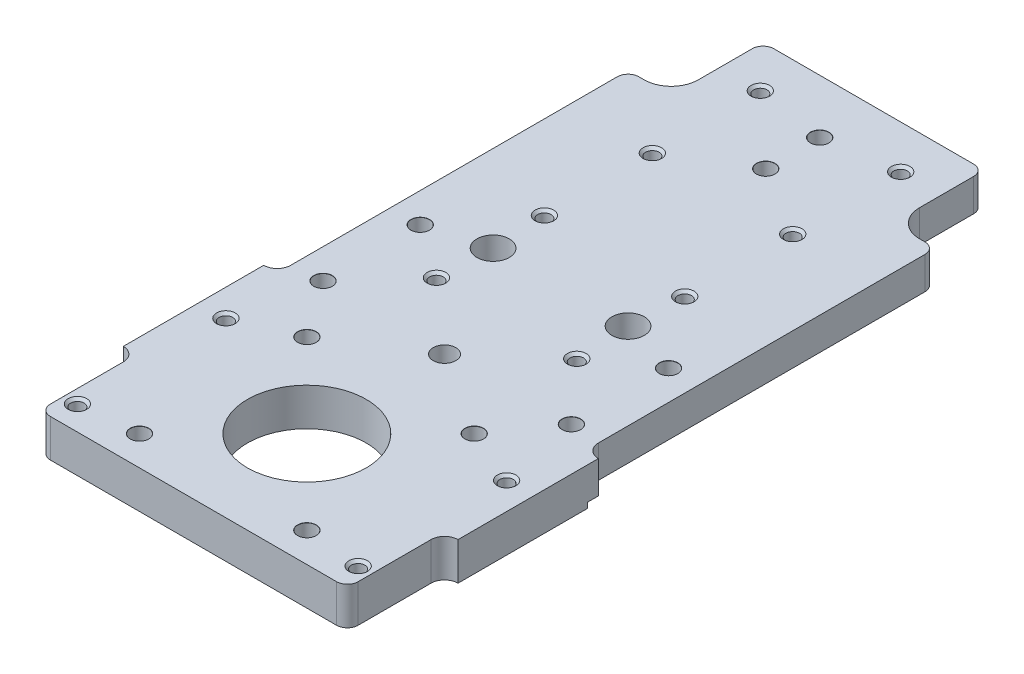
from build123d import *

# Parameters (mm, degrees)
PLATE_MAIN_SKETCH_R             = 11
PLATE_MAIN_SKETCH_R_2           = 3
EXTRUDE_PLATE_MAIN_DEPTH        = 7
CORNER_FILLETS_R                = 2
M3X0_5_TAPPED_HOLES_AT_2_COUNT  = 2
M3X0_5_TAPPED_HOLES_AT_2_PITCH  = 27.5
M3X0_5_TAPPED_HOLES_AT_3_COUNT  = 2
M3X0_5_TAPPED_HOLES_AT_3_PITCH  = 58.823889705
M3X0_5_TAPPED_HOLES_AT_4_COUNT  = 2
M3X0_5_TAPPED_HOLES_AT_4_PITCH  = 66.206117542
M3X0_5_TAPPED_HOLES_AT_5_COUNT  = 2
M3X0_5_TAPPED_HOLES_AT_5_PITCH  = 83.20606949
M3X0_5_TAPPED_HOLES_AT_6_COUNT  = 2
M3X0_5_TAPPED_HOLES_AT_6_PITCH  = 101.307699609
M3X0_5_TAPPED_HOLES_AT_7_COUNT  = 2
M3X0_5_TAPPED_HOLES_AT_7_PITCH  = 120.013540903
M3X0_5_TAPPED_HOLES_AT_8_COUNT  = 2
M3X0_5_TAPPED_HOLES_AT_8_PITCH  = 114.242067558
M3X0_5_TAPPED_HOLES_AT_9_COUNT  = 2
M3X0_5_TAPPED_HOLES_AT_9_PITCH  = 94.399417371
M3X0_5_TAPPED_HOLES_AT_10_COUNT = 2
M3X0_5_TAPPED_HOLES_AT_10_PITCH = 74.640806534
M3X0_5_TAPPED_HOLES_AT_11_COUNT = 2
M3X0_5_TAPPED_HOLES_AT_11_PITCH = 55.056788864
M3X0_5_TAPPED_HOLES_AT_12_COUNT = 2
M3X0_5_TAPPED_HOLES_AT_12_PITCH = 52
M3_COUNTER_BORES_AT_2_COUNT     = 2
M3_COUNTER_BORES_AT_2_PITCH     = 31
M3_COUNTER_BORES_AT_3_COUNT     = 2
M3_COUNTER_BORES_AT_3_PITCH     = 43.840620434
M3_COUNTER_BORES_AT_4_COUNT     = 2
M3_COUNTER_BORES_AT_4_PITCH     = 31
M3_COUNTER_BORES_AT_5_COUNT     = 2
M3_COUNTER_BORES_AT_5_PITCH     = 42.172265768
M3_COUNTER_BORES_AT_6_COUNT     = 2
M3_COUNTER_BORES_AT_6_PITCH     = 56.608303278
M3_COUNTER_BORES_AT_7_COUNT     = 2
M3_COUNTER_BORES_AT_7_PITCH     = 70.86959856
M3_COUNTER_BORES_AT_8_COUNT     = 2
M3_COUNTER_BORES_AT_8_PITCH     = 59.970826241
M3_COUNTER_BORES_AT_9_COUNT     = 2
M3_COUNTER_BORES_AT_9_PITCH     = 101.688249075
M3_COUNTER_BORES_AT_10_COUNT    = 2
M3_COUNTER_BORES_AT_10_PITCH    = 111.581808553
M5X0_8_TAPPED_HOLE1_D           = 4.2
CUT_RECESS_DEPTH                = 1


with BuildPart() as part:
    # Plate Main Sketch → Extrude Plate Main (new body)
    with BuildSketch(Plane(origin=(-158.085545862, 0, 24.679095537), x_dir=(-1, 0, 0), z_dir=(0, 1, 0))):
        with BuildLine():
            Line((-178.585545862, -24.679095537), (-137.585545862, -24.679095537))
            Line((-137.585545862, -24.679095537), (-137.585545862, -12.679095537))
            ThreePointArc((-137.585545862, -12.679095537), (-136.121079768, -9.143561631), (-132.585545862, -7.679095537))
            Line((-132.585545862, -7.679095537), (-129.585545862, -7.679095537))
            Line((-129.585545862, -7.679095537), (-129.585545862, 54.820904463))
            ThreePointArc((-129.585545862, 54.820904463), (-128.853312815, 56.588671416), (-127.085545862, 57.320904463))
            Line((-127.085545862, 57.320904463), (-127.085545862, 83.320904463))
            ThreePointArc((-127.085545862, 83.320904463), (-128.853312815, 84.05313751), (-129.585545862, 85.820904463))
            Line((-129.585545862, 85.820904463), (-129.585545862, 101.320904463))
            Line((-129.585545862, 101.320904463), (-186.585545862, 101.320904463))
            Line((-186.585545862, 101.320904463), (-186.585545862, 85.820904463))
            ThreePointArc((-186.585545862, 85.820904463), (-187.317778909, 84.05313751), (-189.085545862, 83.320904463))
            Line((-189.085545862, 83.320904463), (-189.085545862, 57.320904463))
            ThreePointArc((-189.085545862, 57.320904463), (-187.317778909, 56.588671416), (-186.585545862, 54.820904463))
            Line((-186.585545862, 54.820904463), (-186.585545862, -7.679095537))
            Line((-186.585545862, -7.679095537), (-183.585545862, -7.679095537))
            ThreePointArc((-183.585545862, -7.679095537), (-180.050011956, -9.143561631), (-178.585545862, -12.679095537))
            Line((-178.585545862, -12.679095537), (-178.585545862, -24.679095537))
        make_face()
        with Locations((-158.085545862, 80.320904463)):
            Circle(PLATE_MAIN_SKETCH_R, mode=Mode.SUBTRACT)
        with Locations((-145.585545862, 33.320904463)):
            Circle(PLATE_MAIN_SKETCH_R_2, mode=Mode.SUBTRACT)
        with Locations((-170.585545862, 33.320904463)):
            Circle(PLATE_MAIN_SKETCH_R_2, mode=Mode.SUBTRACT)
    extrude(amount=EXTRUDE_PLATE_MAIN_DEPTH)

    # Corner Fillets
    corner_fillets_edges = [part.edges().sort_by_distance(p)[0] for p in [
        (-28.5, 3.5, 126),
        (-28.5, 3.5, 17),
        (-20.5, 3.5, 0),
        (20.5, 3.5, 0),
        (28.5, 3.5, 17),
        (28.5, 3.5, 126),
    ]]
    fillet(corner_fillets_edges, radius=CORNER_FILLETS_R)

    # Sketch13 → M3x0.5 Tapped Holes (revolve, cut)
    with BuildSketch(Plane(origin=(26, 0, 121.5), x_dir=(0, 0, -1), z_dir=(1, 0, 0))):
        Polygon((0, 0), (0, 7), (1.725, 7), (1.25, 6.525), (1.25, 0), align=None)
    m3x0_5_tapped_holes = revolve(axis=Axis((26, -6.35, 121.5), (0, 1, 0)), mode=Mode.SUBTRACT)

    # M3x0.5 Tapped Holes at 2: M3x0.5 Tapped Holes ×2
    with Locations(*[(0, 0, -i * M3X0_5_TAPPED_HOLES_AT_2_PITCH) for i in range(1, M3X0_5_TAPPED_HOLES_AT_2_COUNT)]):
        add(m3x0_5_tapped_holes, mode=Mode.SUBTRACT)

    # M3x0.5 Tapped Holes at 3: M3x0.5 Tapped Holes ×2
    with Locations(*[Vector(-0.8839945855497452, 0, -0.46749713658880765) * (i * M3X0_5_TAPPED_HOLES_AT_3_PITCH) for i in range(1, M3X0_5_TAPPED_HOLES_AT_3_COUNT)]):
        add(m3x0_5_tapped_holes, mode=Mode.SUBTRACT)

    # M3x0.5 Tapped Holes at 4: M3x0.5 Tapped Holes ×2
    with Locations(*[Vector(-0.5890694311623529, 0, -0.8080824247996377) * (i * M3X0_5_TAPPED_HOLES_AT_4_PITCH) for i in range(1, M3X0_5_TAPPED_HOLES_AT_4_COUNT)]):
        add(m3x0_5_tapped_holes, mode=Mode.SUBTRACT)

    # M3x0.5 Tapped Holes at 5: M3x0.5 Tapped Holes ×2
    with Locations(*[Vector(-0.46871580689935055, 0, -0.8833490206949294) * (i * M3X0_5_TAPPED_HOLES_AT_5_PITCH) for i in range(1, M3X0_5_TAPPED_HOLES_AT_5_COUNT)]):
        add(m3x0_5_tapped_holes, mode=Mode.SUBTRACT)

    # M3x0.5 Tapped Holes at 6: M3x0.5 Tapped Holes ×2
    with Locations(*[Vector(-0.38496580369162126, 0, -0.9229308370555532) * (i * M3X0_5_TAPPED_HOLES_AT_6_PITCH) for i in range(1, M3X0_5_TAPPED_HOLES_AT_6_COUNT)]):
        add(m3x0_5_tapped_holes, mode=Mode.SUBTRACT)

    # M3x0.5 Tapped Holes at 7: M3x0.5 Tapped Holes ×2
    with Locations(*[Vector(-0.32496333085967716, 0, -0.9457266167326497) * (i * M3X0_5_TAPPED_HOLES_AT_7_PITCH) for i in range(1, M3X0_5_TAPPED_HOLES_AT_7_COUNT)]):
        add(m3x0_5_tapped_holes, mode=Mode.SUBTRACT)

    # M3x0.5 Tapped Holes at 8: M3x0.5 Tapped Holes ×2
    with Locations(*[Vector(-0.113793458730633, 0, -0.993504428148219) * (i * M3X0_5_TAPPED_HOLES_AT_8_PITCH) for i in range(1, M3X0_5_TAPPED_HOLES_AT_8_COUNT)]):
        add(m3x0_5_tapped_holes, mode=Mode.SUBTRACT)

    # M3x0.5 Tapped Holes at 9: M3x0.5 Tapped Holes ×2
    with Locations(*[Vector(-0.13771271435815216, 0, -0.9904722148067102) * (i * M3X0_5_TAPPED_HOLES_AT_9_PITCH) for i in range(1, M3X0_5_TAPPED_HOLES_AT_9_COUNT)]):
        add(m3x0_5_tapped_holes, mode=Mode.SUBTRACT)

    # M3x0.5 Tapped Holes at 10: M3x0.5 Tapped Holes ×2
    with Locations(*[Vector(-0.17416746420246676, 0, -0.9847160476062541) * (i * M3X0_5_TAPPED_HOLES_AT_10_PITCH) for i in range(1, M3X0_5_TAPPED_HOLES_AT_10_COUNT)]):
        add(m3x0_5_tapped_holes, mode=Mode.SUBTRACT)

    # M3x0.5 Tapped Holes at 11: M3x0.5 Tapped Holes ×2
    with Locations(*[Vector(-0.23611983677697992, 0, -0.9717239436591096) * (i * M3X0_5_TAPPED_HOLES_AT_11_PITCH) for i in range(1, M3X0_5_TAPPED_HOLES_AT_11_COUNT)]):
        add(m3x0_5_tapped_holes, mode=Mode.SUBTRACT)

    # M3x0.5 Tapped Holes at 12: M3x0.5 Tapped Holes ×2
    with Locations(*[(-i * M3X0_5_TAPPED_HOLES_AT_12_PITCH, 0, 0) for i in range(1, M3X0_5_TAPPED_HOLES_AT_12_COUNT)]):
        add(m3x0_5_tapped_holes, mode=Mode.SUBTRACT)

    # Sketch5 → M3 Counter Bores (revolve, cut)
    with BuildSketch(Plane(origin=(-15.5, 0, 120.5), x_dir=(0, 0, -1), z_dir=(1, 0, 0))):
        Polygon((0, 0), (0, 7), (1.725, 7), (1.7, 6.975), (1.7, 4.5), (3, 4.5), (3, 0), align=None)
    m3_counter_bores = revolve(axis=Axis((-15.5, -6.35, 120.5), (0, 1, 0)), mode=Mode.SUBTRACT)

    # M3 Counter Bores at 2: M3 Counter Bores ×2
    with Locations(*[(i * M3_COUNTER_BORES_AT_2_PITCH, 0, 0) for i in range(1, M3_COUNTER_BORES_AT_2_COUNT)]):
        add(m3_counter_bores, mode=Mode.SUBTRACT)

    # M3 Counter Bores at 3: M3 Counter Bores ×2
    with Locations(*[Vector(0.7071067811865479, 0, -0.7071067811865472) * (i * M3_COUNTER_BORES_AT_3_PITCH) for i in range(1, M3_COUNTER_BORES_AT_3_COUNT)]):
        add(m3_counter_bores, mode=Mode.SUBTRACT)

    # M3 Counter Bores at 4: M3 Counter Bores ×2
    with Locations(*[(0, 0, -i * M3_COUNTER_BORES_AT_4_PITCH) for i in range(1, M3_COUNTER_BORES_AT_4_COUNT)]):
        add(m3_counter_bores, mode=Mode.SUBTRACT)

    # M3 Counter Bores at 5: M3 Counter Bores ×2
    with Locations(*[Vector(-0.1778419978967634, 0, -0.9840590550287557) * (i * M3_COUNTER_BORES_AT_5_PITCH) for i in range(1, M3_COUNTER_BORES_AT_5_COUNT)]):
        add(m3_counter_bores, mode=Mode.SUBTRACT)

    # M3 Counter Bores at 6: M3 Counter Bores ×2
    with Locations(*[Vector(0.6801122409730789, 0, -0.7331080000099417) * (i * M3_COUNTER_BORES_AT_6_PITCH) for i in range(1, M3_COUNTER_BORES_AT_6_COUNT)]):
        add(m3_counter_bores, mode=Mode.SUBTRACT)

    # M3 Counter Bores at 7: M3 Counter Bores ×2
    with Locations(*[Vector(0.5432512781572745, 0, -0.8395701571521512) * (i * M3_COUNTER_BORES_AT_7_PITCH) for i in range(1, M3_COUNTER_BORES_AT_7_COUNT)]):
        add(m3_counter_bores, mode=Mode.SUBTRACT)

    # M3 Counter Bores at 8: M3 Counter Bores ×2
    with Locations(*[Vector(-0.12506080823181873, 0, -0.9921490786390946) * (i * M3_COUNTER_BORES_AT_8_PITCH) for i in range(1, M3_COUNTER_BORES_AT_8_COUNT)]):
        add(m3_counter_bores, mode=Mode.SUBTRACT)

    # M3 Counter Bores at 9: M3 Counter Bores ×2
    with Locations(*[Vector(0.15242665834989907, 0, -0.9883147847848291) * (i * M3_COUNTER_BORES_AT_9_PITCH) for i in range(1, M3_COUNTER_BORES_AT_9_COUNT)]):
        add(m3_counter_bores, mode=Mode.SUBTRACT)

    # M3 Counter Bores at 10: M3 Counter Bores ×2
    with Locations(*[Vector(0.13891153227375555, 0, -0.9903047945967733) * (i * M3_COUNTER_BORES_AT_10_PITCH) for i in range(1, M3_COUNTER_BORES_AT_10_COUNT)]):
        add(m3_counter_bores, mode=Mode.SUBTRACT)

    # M5x0.8 Tapped Hole1 (through all)
    with Locations(Plane(origin=(0, 0, 0), x_dir=(-1, 0, 0), z_dir=(0, -1, 0))):
        with Locations((0, -79.5)):
            Hole(M5X0_8_TAPPED_HOLE1_D / 2)

    # Reccess Sketch → Cut Recess (cut)
    with BuildSketch(Plane(origin=(0, 0, 0), x_dir=(1, 0, 0), z_dir=(0, 1, 0))):
        with BuildLine():
            Line((-8.25, 0), (-8.25, -81))
            ThreePointArc((-8.25, -81), (-9.128679656, -83.121320344), (-11.25, -84))
            Line((-11.25, -84), (-31, -84))
            Line((-31, -84), (-31, 0))
            Line((-31, 0), (-8.25, 0))
        make_face()
        with BuildLine():
            Line((31, 0), (8.25, 0))
            Line((8.25, 0), (8.25, -81))
            ThreePointArc((8.25, -81), (9.128679656, -83.121320344), (11.25, -84))
            Line((11.25, -84), (31, -84))
            Line((31, -84), (31, 0))
        make_face()
    extrude(amount=CUT_RECESS_DEPTH, mode=Mode.SUBTRACT)


solid = part.part
